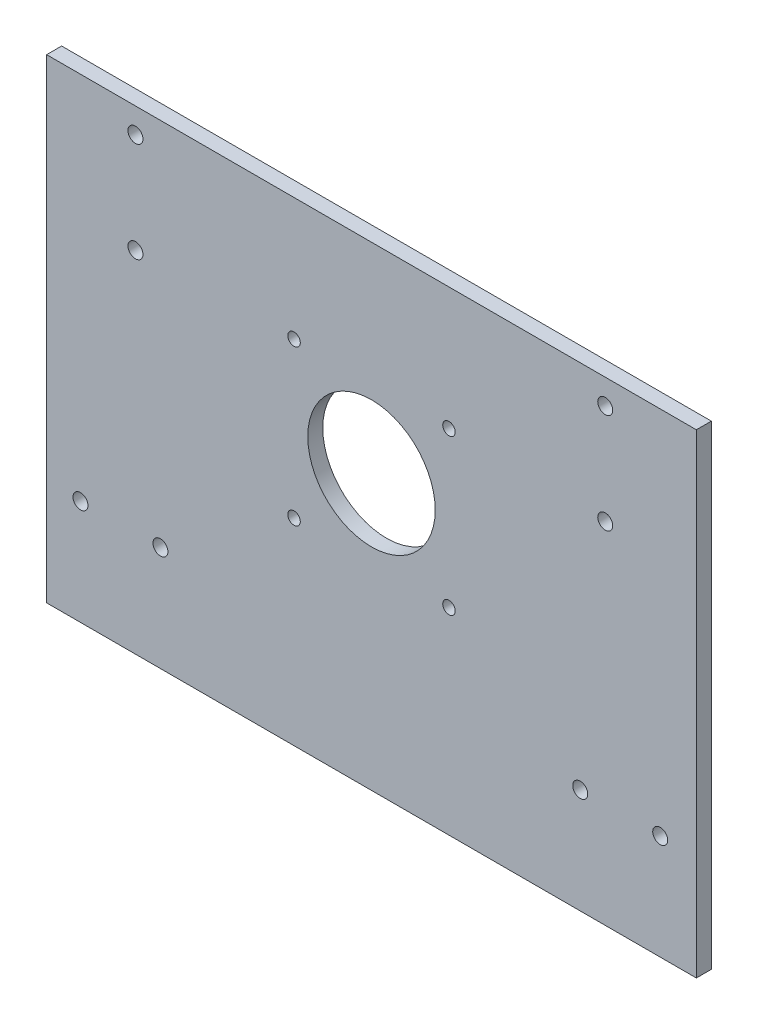
from build123d import *

# Parameters (mm, degrees)
SKETCH_1_W          = 130
SKETCH_1_H          = 95
EXTRUDE_1_DEPTH     = 3
SKETCH_3_R          = 1.5
CUT_EXTRUDE_2_DEPTH = 10
SKETCH_4_R          = 1.5
CUT_EXTRUDE_3_DEPTH = 10
SKETCH_15_R         = 12.75
CUT_EXTRUDE_8_DEPTH = 10
SKETCH_16_R         = 1.25
CUT_EXTRUDE_9_DEPTH = 10


with BuildPart() as part:
    # 草图1 → 凸台-拉伸1 (new body)
    with BuildSketch(Plane.XY):
        Rectangle(SKETCH_1_W, SKETCH_1_H)
    extrude(amount=EXTRUDE_1_DEPTH)

    # 草图3 → 切除-拉伸2 (cut)
    with BuildSketch(Plane(origin=(0, 0, 0), x_dir=(-1, 0, 0), z_dir=(0, 0, -1))):
        with Locations((-57.767112616, -26.5)):
            Circle(SKETCH_3_R)
        with Locations((-41.767112616, -26.5)):
            Circle(SKETCH_3_R)
        with Locations((42.232887384, -26.5)):
            Circle(SKETCH_3_R)
        with Locations((58.232887384, -26.5)):
            Circle(SKETCH_3_R)
    extrude(amount=-CUT_EXTRUDE_2_DEPTH, mode=Mode.SUBTRACT)

    # 草图4 → 切除-拉伸3 (cut)
    with BuildSketch(Plane(origin=(0, 0, 0), x_dir=(-1, 0, 0), z_dir=(0, 0, -1))):
        with Locations((-46.767112616, 42.5)):
            Circle(SKETCH_4_R)
        with Locations((-46.767112616, 22.5)):
            Circle(SKETCH_4_R)
        with Locations((47.232887384, 42.5)):
            Circle(SKETCH_4_R)
        with Locations((47.232887384, 22.5)):
            Circle(SKETCH_4_R)
    extrude(amount=-CUT_EXTRUDE_3_DEPTH, mode=Mode.SUBTRACT)

    # 草图15 → 切除-拉伸8 (cut)
    with BuildSketch(Plane(origin=(0, 0, 0), x_dir=(-1, 0, 0), z_dir=(0, 0, -1))):
        with Locations((0, 7.452587902)):
            Circle(SKETCH_15_R)
    extrude(amount=-CUT_EXTRUDE_8_DEPTH, mode=Mode.SUBTRACT)

    # 草图16 → 切除-拉伸9 (cut)
    with BuildSketch(Plane(origin=(0, 0, 0), x_dir=(-1, 0, 0), z_dir=(0, 0, -1))):
        with Locations((-15.5, 22.952587902)):
            Circle(SKETCH_16_R)
        with Locations((15.5, 22.952587902)):
            Circle(SKETCH_16_R)
        with Locations((15.5, -8.047412098)):
            Circle(SKETCH_16_R)
        with Locations((-15.5, -8.047412098)):
            Circle(SKETCH_16_R)
    extrude(amount=-CUT_EXTRUDE_9_DEPTH, mode=Mode.SUBTRACT)


solid = part.part
